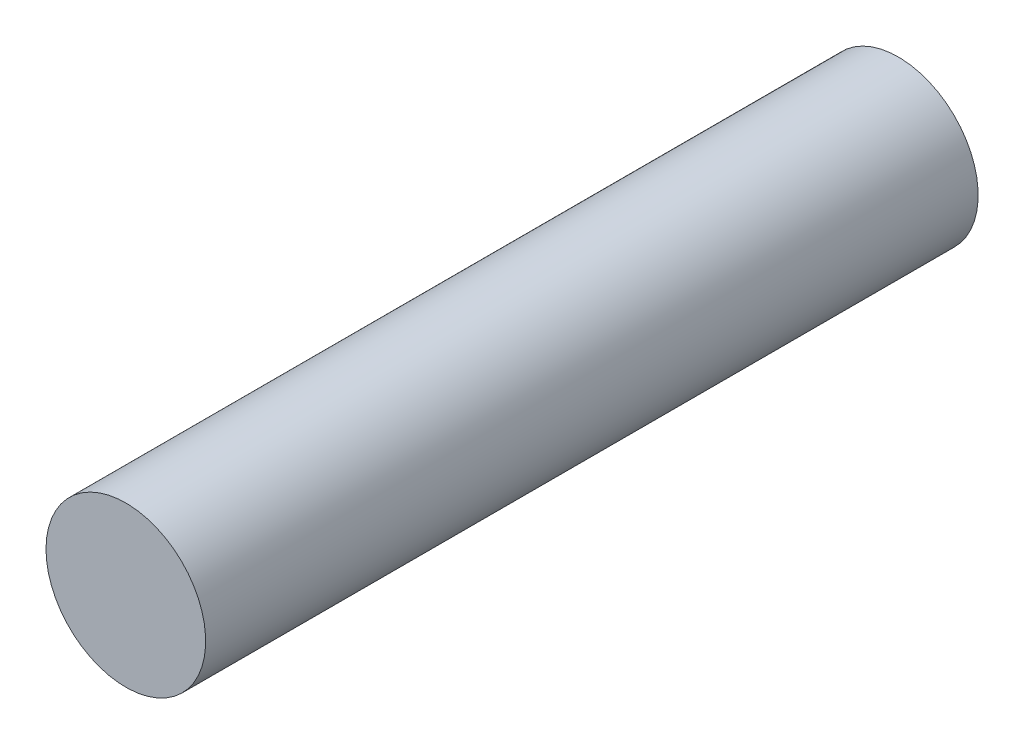
from build123d import *

# Parameters (mm, degrees)
SKETCH1_R           = 3.937
BOSS_EXTRUDE1_DEPTH = 38.1


with BuildPart() as part:
    # Sketch1 → Boss-Extrude1 (new body)
    with BuildSketch(Plane.XY):
        Circle(SKETCH1_R)
    extrude(amount=BOSS_EXTRUDE1_DEPTH)


solid = part.part
